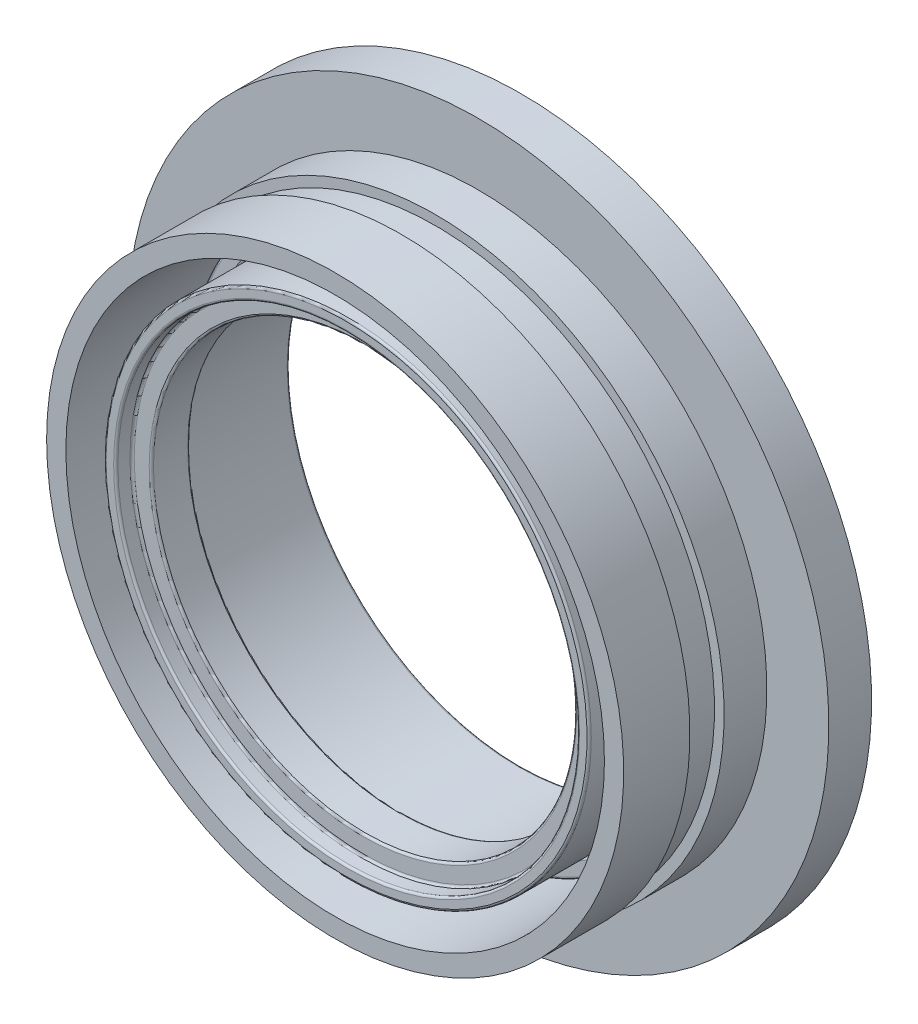
from build123d import *


with BuildPart() as part:
    # Sketch1 → Revolve1 (revolve)
    with BuildSketch(Plane(origin=(0, 0, 0), x_dir=(1, 0, 0), z_dir=(0, 1, 0))):
        with BuildLine():
            Line((27, 30.088078699), (27, 26.088078699))
            Line((27, 26.088078699), (26.1, 26.088078699))
            Line((26.1, 26.088078699), (26.1, 22.888078699))
            Line((26.1, 22.888078699), (27, 22.888078699))
            Line((27, 22.888078699), (27, 16.688078699))
            Line((27, 16.688078699), (25.2, 16.688078699))
            Line((25.2, 16.688078699), (25.2, 32.655378704))
            ThreePointArc((25.2, 32.655378704), (25.141421356, 32.79680006), (25, 32.855378704))
            Line((25, 32.855378704), (24.9, 32.855378704))
            ThreePointArc((24.9, 32.855378704), (24.758578644, 32.79680006), (24.7, 32.655378704))
            Line((24.7, 32.655378704), (24.7, 27.655378704))
            ThreePointArc((24.7, 27.655378704), (24.641421356, 27.513957348), (24.5, 27.455378704))
            Line((24.5, 27.455378704), (23.4, 27.455378704))
            ThreePointArc((23.4, 27.455378704), (23.258578644, 27.513957348), (23.2, 27.655378704))
            Line((23.2, 27.655378704), (23.2, 32.655378704))
            ThreePointArc((23.2, 32.655378704), (23.141421356, 32.79680006), (23, 32.855378704))
            Line((23, 32.855378704), (22.9, 32.855378704))
            ThreePointArc((22.9, 32.855378704), (22.758578644, 32.79680006), (22.7, 32.655378704))
            Line((22.7, 32.655378704), (22.7, 17.959377585))
            ThreePointArc((22.7, 17.959377585), (22.641421356, 17.817956229), (22.5, 17.759377585))
            Line((22.5, 17.759377585), (21.8, 17.759377585))
            ThreePointArc((21.8, 17.759377585), (21.658578644, 17.817956229), (21.6, 17.959377585))
            Line((21.6, 17.959377585), (21.6, 19.088078699))
            ThreePointArc((21.6, 19.088078699), (21.541421356, 19.229500055), (21.4, 19.288078699))
            Line((21.4, 19.288078699), (20, 19.288078699))
            ThreePointArc((20, 19.288078699), (19.858578644, 19.346657343), (19.8, 19.488078699))
            Line((19.8, 19.488078699), (19.8, 22.688078699))
            ThreePointArc((19.8, 22.688078699), (19.858578644, 22.829500055), (20, 22.888078699))
            Line((20, 22.888078699), (21.4, 22.888078699))
            ThreePointArc((21.4, 22.888078699), (21.541421356, 22.946657343), (21.6, 23.088078699))
            Line((21.6, 23.088078699), (21.6, 33.8))
            ThreePointArc((21.6, 33.8), (21.658578644, 33.941421356), (21.8, 34))
            Line((21.8, 34), (22.5, 34))
            Line((22.5, 34), (23.5, 34))
            ThreePointArc((23.5, 34), (23.641421356, 33.941421356), (23.7, 33.8))
            Line((23.7, 33.8), (23.7, 28.155378704))
            ThreePointArc((23.7, 28.155378704), (23.758578644, 28.013957348), (23.9, 27.955378704))
            Line((23.9, 27.955378704), (24, 27.955378704))
            ThreePointArc((24, 27.955378704), (24.141421356, 28.013957348), (24.2, 28.155378704))
            Line((24.2, 28.155378704), (24.2, 33.888078699))
            ThreePointArc((24.2, 33.888078699), (24.258578644, 34.029500055), (24.4, 34.088078699))
            Line((24.4, 34.088078699), (25.2, 34.088078699))
            Line((25.2, 34.088078699), (32.8, 34.088078699))
            Line((32.8, 34.088078699), (32.8, 30.088078699))
            Line((32.8, 30.088078699), (27, 30.088078699))
        make_face()
    revolve(axis=Axis((0, 0, -34), (0, 0, 1)))


solid = part.part
